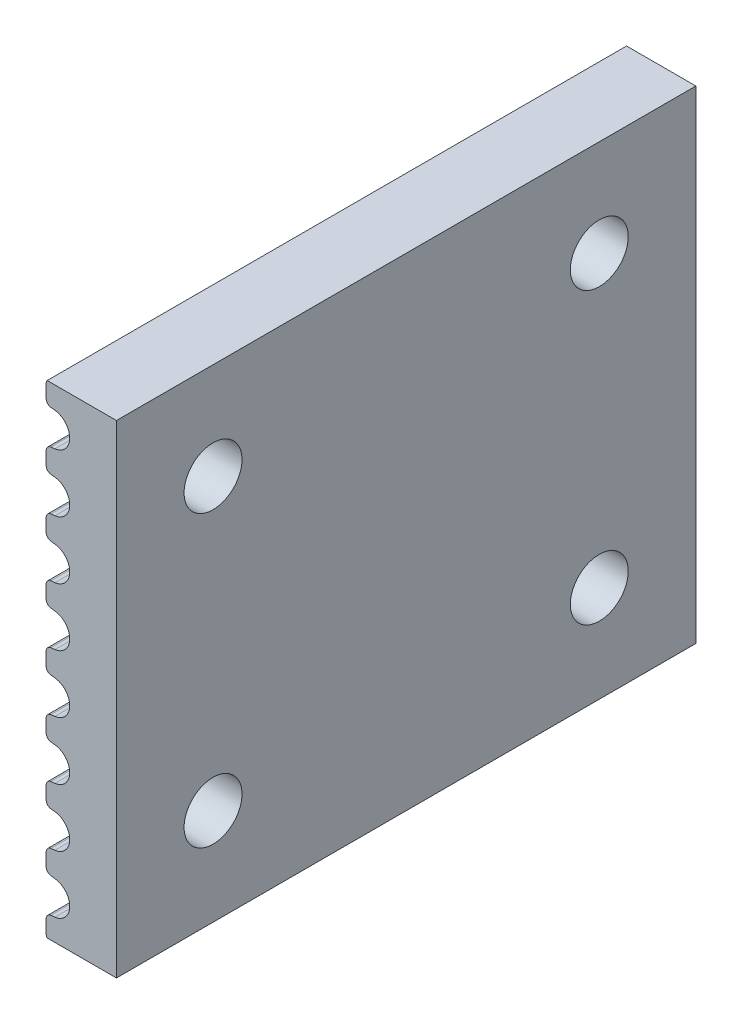
from build123d import *

# Parameters (mm, degrees)
EXTRUDE_1_DEPTH     = 30
SKETCH_6_W          = 6.240292705
SKETCH_6_H          = 1
SKETCH_6_W_2        = 7.717831713
CUT_EXTRUDE_2_DEPTH = 40.223795167
SKETCH_7_R          = 1.5
CUT_EXTRUDE_3_DEPTH = 39.712719603


with BuildPart() as part:
    # 草图1 → 凸台-拉伸1 (new body)
    with BuildSketch(Plane.XY):
        with BuildLine():
            Line((-1.921697422, 0.033861837), (-1.921697422, -0.642863182))
            ThreePointArc((-1.921697422, -0.642863182), (-1.852992266, -0.824207341), (-1.681372871, -0.914500673))
            Line((-1.681372871, -0.914500673), (-1.465671093, -0.940985521))
            ThreePointArc((-1.465671093, -0.940985521), (-0.920105945, -1.228021231), (-0.701697422, -1.804500673))
            Line((-0.701697422, -1.804500673), (1.718696973, -1.804500673))
            Line((1.718696973, -1.804500673), (1.718696973, 25.195499327))
            Line((1.718696973, 25.195499327), (-0.701697422, 25.195499327))
            ThreePointArc((-0.701697422, 25.195499327), (-0.920105945, 24.619019885), (-1.465671093, 24.331984175))
            Line((-1.465671093, 24.331984175), (-1.681372871, 24.305499327))
            ThreePointArc((-1.681372871, 24.305499327), (-1.852992266, 24.215205996), (-1.921697422, 24.033861837))
            Line((-1.921697422, 24.033861837), (-1.921697422, 23.357136818))
            ThreePointArc((-1.921697422, 23.357136818), (-1.852992266, 23.175792659), (-1.681372871, 23.085499327))
            Line((-1.681372871, 23.085499327), (-1.465671093, 23.059014479))
            ThreePointArc((-1.465671093, 23.059014479), (-0.701697422, 22.195499327), (-1.465671093, 21.331984175))
            Line((-1.465671093, 21.331984175), (-1.681372871, 21.305499327))
            ThreePointArc((-1.681372871, 21.305499327), (-1.852992266, 21.215205996), (-1.921697422, 21.033861837))
            Line((-1.921697422, 21.033861837), (-1.921697422, 20.357136818))
            ThreePointArc((-1.921697422, 20.357136818), (-1.852992266, 20.175792659), (-1.681372871, 20.085499327))
            Line((-1.681372871, 20.085499327), (-1.465671093, 20.059014479))
            ThreePointArc((-1.465671093, 20.059014479), (-0.701697422, 19.195499327), (-1.465671093, 18.331984175))
            Line((-1.465671093, 18.331984175), (-1.681372871, 18.305499327))
            ThreePointArc((-1.681372871, 18.305499327), (-1.852992266, 18.215205996), (-1.921697422, 18.033861837))
            Line((-1.921697422, 18.033861837), (-1.921697422, 17.357136818))
            ThreePointArc((-1.921697422, 17.357136818), (-1.852992266, 17.175792659), (-1.681372871, 17.085499327))
            Line((-1.681372871, 17.085499327), (-1.465671093, 17.059014479))
            ThreePointArc((-1.465671093, 17.059014479), (-0.701697422, 16.195499327), (-1.465671093, 15.331984175))
            Line((-1.465671093, 15.331984175), (-1.681372871, 15.305499327))
            ThreePointArc((-1.681372871, 15.305499327), (-1.852992266, 15.215205996), (-1.921697422, 15.033861837))
            Line((-1.921697422, 15.033861837), (-1.921697422, 14.357136818))
            ThreePointArc((-1.921697422, 14.357136818), (-1.852992266, 14.175792659), (-1.681372871, 14.085499327))
            Line((-1.681372871, 14.085499327), (-1.465671093, 14.059014479))
            ThreePointArc((-1.465671093, 14.059014479), (-0.701697422, 13.195499327), (-1.465671093, 12.331984175))
            Line((-1.465671093, 12.331984175), (-1.681372871, 12.305499327))
            ThreePointArc((-1.681372871, 12.305499327), (-1.852992266, 12.215205996), (-1.921697422, 12.033861837))
            Line((-1.921697422, 12.033861837), (-1.921697422, 11.357136818))
            ThreePointArc((-1.921697422, 11.357136818), (-1.852992266, 11.175792659), (-1.681372871, 11.085499327))
            Line((-1.681372871, 11.085499327), (-1.465671093, 11.059014479))
            ThreePointArc((-1.465671093, 11.059014479), (-0.701697422, 10.195499327), (-1.465671093, 9.331984175))
            Line((-1.465671093, 9.331984175), (-1.681372871, 9.305499327))
            ThreePointArc((-1.681372871, 9.305499327), (-1.852992266, 9.215205996), (-1.921697422, 9.033861837))
            Line((-1.921697422, 9.033861837), (-1.921697422, 8.357136818))
            ThreePointArc((-1.921697422, 8.357136818), (-1.852992266, 8.175792659), (-1.681372871, 8.085499327))
            Line((-1.681372871, 8.085499327), (-1.465671093, 8.059014479))
            ThreePointArc((-1.465671093, 8.059014479), (-0.701697422, 7.195499327), (-1.465671093, 6.331984175))
            Line((-1.465671093, 6.331984175), (-1.681372871, 6.305499327))
            ThreePointArc((-1.681372871, 6.305499327), (-1.852992266, 6.215205996), (-1.921697422, 6.033861837))
            Line((-1.921697422, 6.033861837), (-1.921697422, 5.357136818))
            ThreePointArc((-1.921697422, 5.357136818), (-1.852992266, 5.175792659), (-1.681372871, 5.085499327))
            Line((-1.681372871, 5.085499327), (-1.465671093, 5.059014479))
            ThreePointArc((-1.465671093, 5.059014479), (-0.701697422, 4.195499327), (-1.465671093, 3.331984175))
            Line((-1.465671093, 3.331984175), (-1.681372871, 3.305499327))
            ThreePointArc((-1.681372871, 3.305499327), (-1.852992266, 3.215205996), (-1.921697422, 3.033861837))
            Line((-1.921697422, 3.033861837), (-1.921697422, 2.357136818))
            ThreePointArc((-1.921697422, 2.357136818), (-1.852992266, 2.175792659), (-1.681372871, 2.085499327))
            Line((-1.681372871, 2.085499327), (-1.465671093, 2.059014479))
            ThreePointArc((-1.465671093, 2.059014479), (-0.701697422, 1.195499327), (-1.465671093, 0.331984175))
            Line((-1.465671093, 0.331984175), (-1.681372871, 0.305499327))
            ThreePointArc((-1.681372871, 0.305499327), (-1.852992266, 0.215205996), (-1.921697422, 0.033861837))
        make_face()
    extrude(amount=EXTRUDE_1_DEPTH)

    # 草图6 → 切除-拉伸2 (cut, through all)
    with BuildSketch(Plane.XY.offset(30)):
        with Locations((-1.40144938, 24.695499327)):
            Rectangle(SKETCH_6_W, SKETCH_6_H)
        with Locations((-2.140218884, -1.304500673)):
            Rectangle(SKETCH_6_W_2, SKETCH_6_H)
    extrude(amount=-CUT_EXTRUDE_2_DEPTH, mode=Mode.SUBTRACT)

    # 草图7 → 切除-拉伸3 (cut, through all)
    with BuildSketch(Plane(origin=(1.718696973, 0, 0), x_dir=(0, 0, -1), z_dir=(1, 0, 0))):
        with Locations((-25, 19.195499327)):
            Circle(SKETCH_7_R)
        with Locations((-25, 4.195499327)):
            Circle(SKETCH_7_R)
        with Locations((-5, 4.195499327)):
            Circle(SKETCH_7_R)
        with Locations((-5, 19.195499327)):
            Circle(SKETCH_7_R)
    extrude(amount=-CUT_EXTRUDE_3_DEPTH, mode=Mode.SUBTRACT)


solid = part.part
